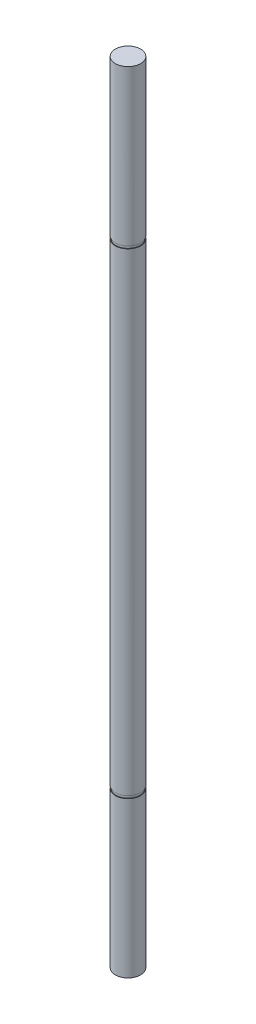
from build123d import *

# Parameters (mm, degrees)
SKETCH_1_R      = 4
EXTRUDE_1_DEPTH = 125
SKETCH_3_W      = 5
SKETCH_3_H      = 0.8


with BuildPart() as part:
    # 草图1 → 凸台-拉伸1 (new, symmetric)
    with BuildSketch(Plane(origin=(0, 0, 0), x_dir=(1, 0, 0), z_dir=(0, 1, 0))):
        Circle(SKETCH_1_R)
    extrude(amount=EXTRUDE_1_DEPTH, both=True)

    # 草图3 → 切除-旋转1 (revolve, cut)
    with BuildSketch(Plane(origin=(0, 0, 0), x_dir=(0, 0, -1), z_dir=(1, 0, 0))):
        with Locations((6.3, 75.4)):
            Rectangle(SKETCH_3_W, SKETCH_3_H)
    cut_revolve_1 = revolve(axis=Axis((0, 125, 0), (0, -1, 0)), mode=Mode.SUBTRACT)

    # 镜向1: 切除-旋转1 across plane
    add(cut_revolve_1.mirror(Plane.ZX), mode=Mode.SUBTRACT)


solid = part.part
